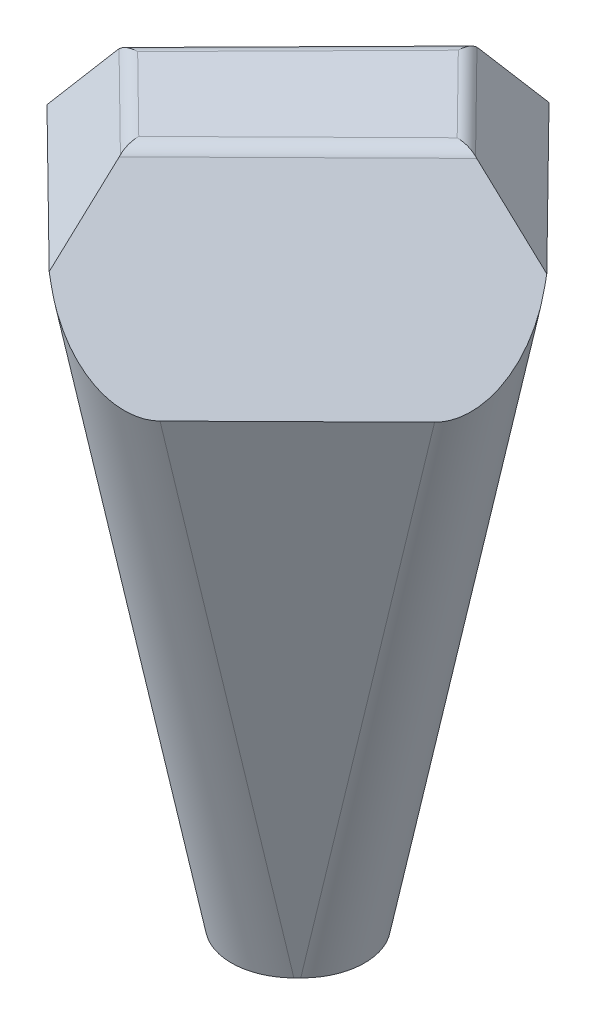
from build123d import *

# Parameters (mm, degrees)
SKETCH3_W           = 50.8
SKETCH3_H           = 114.3
BOSS_EXTRUDE5_DEPTH = 50.8
DRAFT2_ANGLE        = 7
CHAMFER22_SIZE      = 35.56
CHAMFER22_SIZE_2    = 36.100146123
CHAMFER26_SIZE      = 12.7
CHAMFER26_SIZE_2    = 10.982965741
CHAMFER27_SIZE      = 27.462526176
CHAMFER27_SIZE_2    = 20.32
CHAMFER28_SIZE      = 32.227786218
CHAMFER28_SIZE_2    = 20.32
FILLET36_R          = 2.54
FILLET41_R          = 10.16
SHELL2_T            = -1.27


with BuildPart() as part:
    # Sketch3 → Boss-Extrude5 (new body)
    with BuildSketch(Plane.XY):
        Rectangle(SKETCH3_W, SKETCH3_H)
    extrude(amount=BOSS_EXTRUDE5_DEPTH)

    # Draft2
    draft2_faces = [part.faces().sort_by_distance(p)[0] for p in [
        (0, 0, 50.8),
        (25.4, 0, 25.4),
        (0, 0, 0),
        (-25.4, 0, 25.4),
    ]]
    draft(draft2_faces, Plane(origin=(-25.4, -57.15, 50.8), x_dir=(0, 0, -1), z_dir=(0, -1, 0)), DRAFT2_ANGLE)

    # Chamfer22
    # the kernel refuses this chamfer: 36.100146123, 35.56 mm, written as the material it takes off along each edge
    with BuildSketch(Plane(origin=(14.164548215, -148.655411614, 39.564548215), x_dir=(0.04243090311992196, 0.11662547522410431, -0.9922691756721962), z_dir=(0.1209742911513545, 0.9852565360152932, 0.1209742911513545)), Plane(origin=(-50.669727097, 148.655411614, 76.069727097), x_dir=(-0.04243090311992182, 0.11662547522410434, -0.9922691756721962), z_dir=(0.1209742911513545, -0.9852565360152932, -0.1209742911513545))) as chamfer22_piece_1:
        Polygon((CHAMFER22_SIZE * 0.999610675702, CHAMFER22_SIZE * 0.0279015595125), (-CHAMFER22_SIZE_2 * 0.0427448365612, CHAMFER22_SIZE_2 * 0.999086021807), (0, 0), align=None)
    extrude(amount=301.759808092, mode=Mode.SUBTRACT)
    with BuildSketch(Plane(origin=(14.164548215, -148.655411614, 11.235451785), x_dir=(0.04160965436003197, 0.11672908614577471, 0.9922917701521116), z_dir=(0.1209742911513545, 0.9852565360152932, -0.1209742911513545)), Plane(origin=(-50.669727097, 148.655411614, -25.269727097), x_dir=(-0.04160965436003206, 0.11672908614577471, 0.9922917701521116), z_dir=(0.1209742911513545, -0.9852565360152932, 0.1209742911513545))) as chamfer22_piece_2:
        Polygon((CHAMFER22_SIZE_2 * 0.999633437363, -CHAMFER22_SIZE_2 * 0.0270738052216), (-CHAMFER22_SIZE * 0.0419175116292, -CHAMFER22_SIZE * 0.999121074855), (0, 0), align=None)
    extrude(amount=301.759808092, mode=Mode.SUBTRACT)

    # Chamfer26
    # the kernel refuses this chamfer: 12.7, 10.982965741 mm, written as the material it takes off along each edge
    with BuildSketch(Plane(origin=(62.353919786, 57.15, 45.600752144), x_dir=(-0.10253351623411874, -0.9895888066791988, 0.10099936506685082), z_dir=(-0.7017569520656596, 0, -0.7124164373647731))) as chamfer26_piece_1:
        Polygon((CHAMFER26_SIZE * 0.999621916911, CHAMFER26_SIZE * 0.0274958766106), (CHAMFER26_SIZE_2 * 0.14392356894, CHAMFER26_SIZE_2 * 0.989588806705), (0, 0), align=None)
    extrude(amount=116.368475455, mode=Mode.SUBTRACT)
    with BuildSketch(Plane(origin=(20.200752144, 57.15, 87.753919786), x_dir=(0.10099936506686123, -0.9895888066791988, -0.10253351623410831), z_dir=(-0.7124164373647012, 0, -0.7017569520657325))) as chamfer26_piece_2:
        Polygon((CHAMFER26_SIZE * 0.999621916911, -CHAMFER26_SIZE * 0.0274958766106), (CHAMFER26_SIZE_2 * 0.14392356894, -CHAMFER26_SIZE_2 * 0.989588806705), (0, 0), align=None)
    extrude(amount=116.368475455, mode=Mode.SUBTRACT)

    # Chamfer27
    # the kernel refuses this chamfer: 27.462526176, 20.32 mm, written as the material it takes off along each edge
    with BuildSketch(Plane(origin=(85.378052857, 57.15, -16.24516911), x_dir=(-0.10283002660704509, -0.9892058931774511, -0.10439198499403901), z_dir=(-0.7124164373647012, 0, 0.7017569520657325))) as chamfer27_piece_1:
        Polygon((CHAMFER27_SIZE * 0.999690938869, -CHAMFER27_SIZE * 0.0248601439751), (CHAMFER27_SIZE_2 * 0.146532252091, -CHAMFER27_SIZE_2 * 0.989205893177), (0, 0), align=None)
    extrude(amount=179.645229373, mode=Mode.SUBTRACT)

    # Chamfer28
    # the kernel refuses this chamfer: 32.227786218, 20.32 mm, written as the material it takes off along each edge
    with BuildSketch(Plane(origin=(50.702210768, 57.15, -69.17266836), x_dir=(0.10631921382033309, -0.9888013870052722, 0.10472841939548341), z_dir=(-0.7017569520656596, 0, 0.7124164373647731))) as chamfer28_piece_1:
        Polygon((CHAMFER28_SIZE * 0.999755198418, CHAMFER28_SIZE * 0.0221256235269), (CHAMFER28_SIZE_2 * 0.149237451923, CHAMFER28_SIZE_2 * 0.988801387005), (0, 0), align=None)
    extrude(amount=205.453325716, mode=Mode.SUBTRACT)

    # Fillet36
    fillet36_edges = [part.edges().sort_by_distance(p)[0] for p in [
        (13.620964483, 57.15, 11.778226285),
        (7.018121545, 57.15, 32.419663344),
        (-13.620970138, 57.15, 39.021756036),
        (-7.0181272, 57.15, 18.380318978),
    ]]
    fillet(fillet36_edges, radius=FILLET36_R)

    # Fillet41
    fillet41_edges = [part.edges().sort_by_distance(p)[0] for p in [
        (0, -13.528827954, 50.628730432),
        (0, -15.876331706, 0.368905118),
        (25.400607617, -13.597419467, 25.591459835),
        (-24.841008934, -15.876331706, 25.587241799),
    ]]
    fillet(fillet41_edges, radius=FILLET41_R)

    # Shell2
    shell2_openings = [part.faces().sort_by_distance(p)[0] for p in [
        (0, -57.15, 25.396792281),
    ]]
    offset(amount=SHELL2_T, openings=shell2_openings)


solid = part.part
